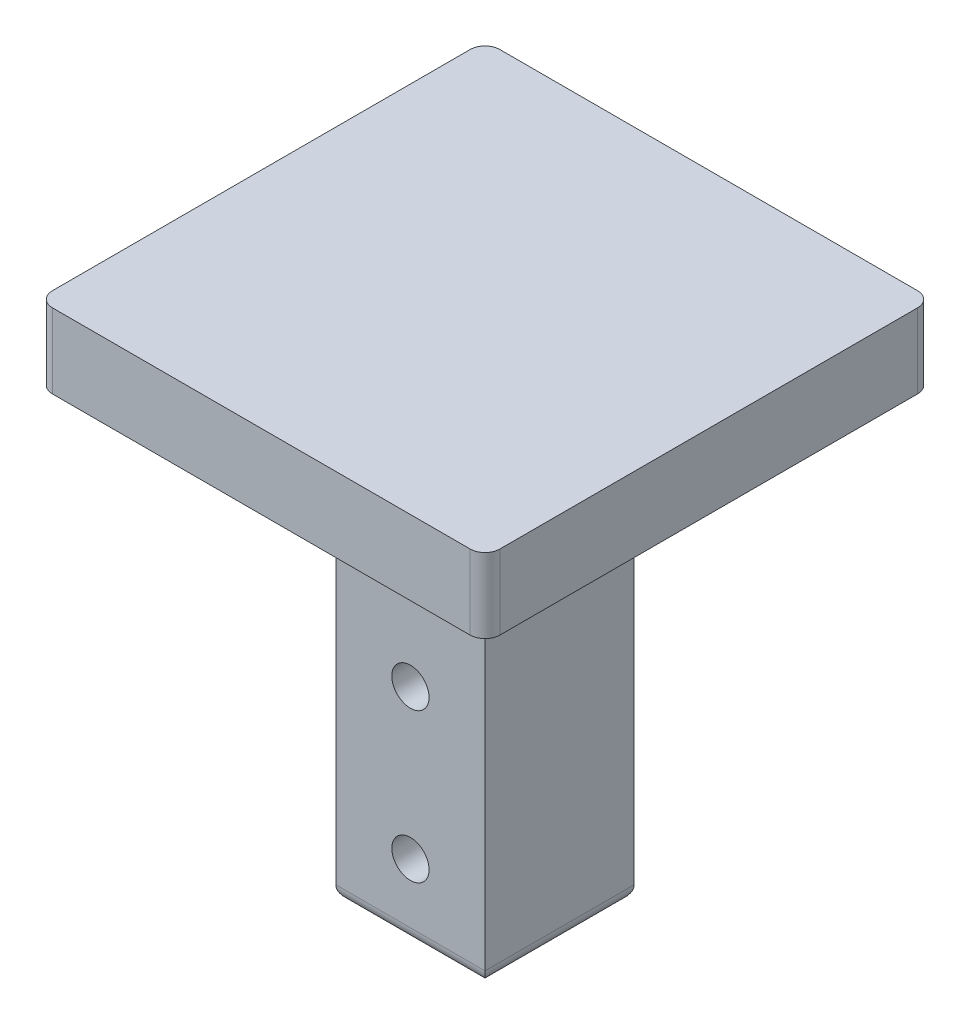
from build123d import *

# Parameters (mm, degrees)
SKETCH1_W           = 20
SKETCH1_H           = 20
BOSS_EXTRUDE1_DEPTH = 60
SKETCH2_W           = 60
SKETCH2_H           = 60
BOSS_EXTRUDE2_DEPTH = 10
FILLET1_R           = 2
SKETCH3_R           = 2.5
CUT_EXTRUDE1_DEPTH  = 79.102496759


with BuildPart() as part:
    # Sketch1 → Boss-Extrude1 (new body)
    with BuildSketch(Plane(origin=(0, 0, 0), x_dir=(1, 0, 0), z_dir=(0, 1, 0))):
        Rectangle(SKETCH1_W, SKETCH1_H)
    extrude(amount=-BOSS_EXTRUDE1_DEPTH)

    # Sketch2 → Boss-Extrude2 (add)
    with BuildSketch(Plane(origin=(0, 0, 0), x_dir=(1, 0, 0), z_dir=(0, 1, 0))):
        Rectangle(SKETCH2_W, SKETCH2_H)
    extrude(amount=BOSS_EXTRUDE2_DEPTH)

    # Fillet1
    fillet1_edges = [part.edges().sort_by_distance(p)[0] for p in [
        (0, -60, -10),
        (-10, -60, 0),
        (0, -60, 10),
        (10, -60, 0),
        (30, 5, 30),
        (30, 5, -30),
        (-30, 5, -30),
        (-30, 5, 30),
    ]]
    fillet(fillet1_edges, radius=FILLET1_R)

    # Sketch3 → Cut-Extrude1 (cut, through all)
    with BuildSketch(Plane.XY.offset(10)):
        with Locations((0, -30)):
            Circle(SKETCH3_R)
        with Locations((0, -50)):
            Circle(SKETCH3_R)
    extrude(amount=-CUT_EXTRUDE1_DEPTH, mode=Mode.SUBTRACT)


solid = part.part
